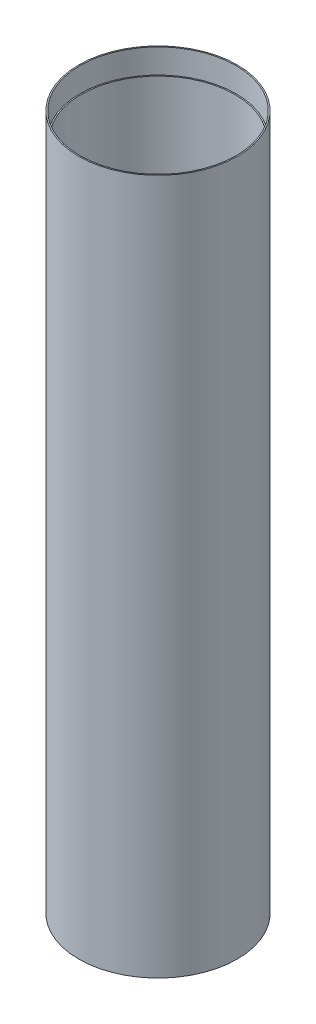
from build123d import *


with BuildPart() as part:
    # Szkic1 → Obrót1 (revolve)
    with BuildSketch(Plane.XY):
        Polygon((64, 285), (65, 285), (65, -285), (64, -285), (64, -265), (63, -265), (63, 265), (64, 265), align=None)
    revolve(axis=Axis((0, 0, 0), (0, 1, 0)))


solid = part.part
